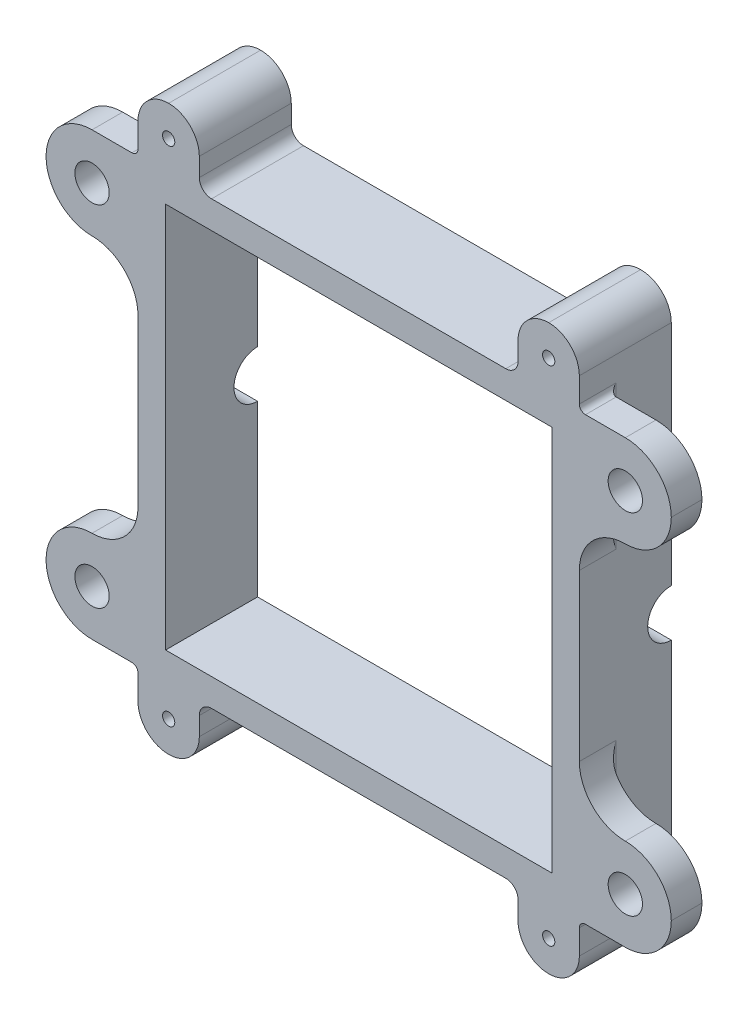
from build123d import *

# Parameters (mm, degrees)
SKETCH1_W            = 91.44
SKETCH1_H            = 91.44
BOSS_EXTRUDE1_DEPTH  = 19.05
SKETCH2_W            = 80.01
SKETCH2_H            = 80.01
CUT_EXTRUDE1_DEPTH   = 68.405780909
SKETCH3_R            = 4.8895
CUT_EXTRUDE2_DEPTH   = 104.992761767
SKETCH4_W            = 12.7
SKETCH4_H            = 12.7
BOSS_EXTRUDE2_DEPTH  = 19.05
SKETCH5_R            = 1.27
CUT_EXTRUDE3_DEPTH   = 77.590582319
FILLET1_R            = 6.35
SKETCH6_W            = 12.7
SKETCH6_H            = 12.7
SKETCH6_R            = 1.27
BOSS_EXTRUDE3_DEPTH  = 19.05
FILLET4_R            = 6.35
FILLET1_OF_MIRROR8_R = 6.35
FILLET4_OF_MIRROR8_R = 6.35
FILLET5_R            = 2.54
SKETCH7_W            = 19.05
SKETCH7_H            = 19.05
SKETCH7_R            = 3.556
BOSS_EXTRUDE4_DEPTH  = 6.35
FILLET6_R            = 9.525
FILLET7_R            = 1.27
FILLET8_R            = 1.27


with BuildPart() as part:
    # Sketch1 → Boss-Extrude1 (new body)
    with BuildSketch(Plane.XY):
        Rectangle(SKETCH1_W, SKETCH1_H)
    extrude(amount=BOSS_EXTRUDE1_DEPTH)

    # Sketch2 → Cut-Extrude1 (cut, through all)
    with BuildSketch(Plane.XY.offset(19.05)):
        Rectangle(SKETCH2_W, SKETCH2_H)
    extrude(amount=-CUT_EXTRUDE1_DEPTH, mode=Mode.SUBTRACT)

    # Sketch3 → Cut-Extrude2 (cut, through all)
    with BuildSketch(Plane(origin=(45.72, 0, 0), x_dir=(0, 0, -1), z_dir=(1, 0, 0))):
        Circle(SKETCH3_R)
        with Locations((0, 57.404)):
            Circle(SKETCH3_R)
        with Locations((0, -57.404)):
            Circle(SKETCH3_R)
    extrude(amount=-CUT_EXTRUDE2_DEPTH, mode=Mode.SUBTRACT)

    # Sketch4 → Boss-Extrude2 (add, through all)
    with BuildSketch(Plane(origin=(0, 0, 0), x_dir=(-1, 0, 0), z_dir=(0, 0, -1))):
        with Locations((-39.37, 52.07)):
            Rectangle(SKETCH4_W, SKETCH4_H)
    boss_extrude2 = extrude(amount=-BOSS_EXTRUDE2_DEPTH)

    # Sketch5 → Cut-Extrude3 (cut, through all)
    with BuildSketch(Plane.XY.offset(19.05)):
        with Locations((39.37, 52.07)):
            Circle(SKETCH5_R)
    cut_extrude3 = extrude(amount=-CUT_EXTRUDE3_DEPTH, mode=Mode.SUBTRACT)

    # Fillet1
    fillet1_edges = [part.edges().sort_by_distance(p)[0] for p in [
        (33.02, 58.42, 9.525),
        (45.72, 58.42, 9.525),
    ]]
    fillet(fillet1_edges, radius=FILLET1_R - 0.0001)  # a hair under: the kernel refuses the full size

    # Sketch6 → Boss-Extrude3 (add, through all)
    with BuildSketch(Plane(origin=(0, 0, 0), x_dir=(-1, 0, 0), z_dir=(0, 0, -1))):
        with Locations((-39.37, -52.07)):
            Rectangle(SKETCH6_W, SKETCH6_H)
        with Locations((-39.37, -52.07)):
            Circle(SKETCH6_R, mode=Mode.SUBTRACT)
    boss_extrude3 = extrude(amount=-BOSS_EXTRUDE3_DEPTH)

    # Fillet4
    fillet4_edges = [part.edges().sort_by_distance(p)[0] for p in [
        (45.72, -58.42, 9.525),
        (33.02, -58.42, 9.525),
    ]]
    fillet(fillet4_edges, radius=FILLET4_R - 0.0001)  # a hair under: the kernel refuses the full size

    # Mirror8: Boss-Extrude2, Cut-Extrude3, Boss-Extrude3 across plane
    add(boss_extrude2.mirror(Plane(origin=(0, 0, 0), x_dir=(0, 0, 1), z_dir=(1, 0, 0))))
    add(cut_extrude3.mirror(Plane(origin=(0, 0, 0), x_dir=(0, 0, 1), z_dir=(1, 0, 0))), mode=Mode.SUBTRACT)
    add(boss_extrude3.mirror(Plane(origin=(0, 0, 0), x_dir=(0, 0, 1), z_dir=(1, 0, 0))))

    # Fillet1 of Mirror8
    fillet1_of_mirror8_edges = [part.edges().sort_by_distance(p)[0] for p in [
        (-33.02, 58.42, 9.525),
        (-45.72, 58.42, 9.525),
    ]]
    fillet(fillet1_of_mirror8_edges, radius=FILLET1_OF_MIRROR8_R - 0.0001)  # a hair under: the kernel refuses the full size

    # Fillet4 of Mirror8
    fillet4_of_mirror8_edges = [part.edges().sort_by_distance(p)[0] for p in [
        (-45.72, -58.42, 9.525),
        (-33.02, -58.42, 9.525),
    ]]
    fillet(fillet4_of_mirror8_edges, radius=FILLET4_OF_MIRROR8_R - 0.0001)  # a hair under: the kernel refuses the full size

    # Fillet5
    fillet5_edges = [part.edges().sort_by_distance(p)[0] for p in [
        (-33.02, 45.72, 9.525),
        (-33.02, -45.72, 9.525),
        (33.02, 45.72, 9.525),
        (33.02, -45.72, 9.525),
    ]]
    fillet(fillet5_edges, radius=FILLET5_R)

    # Sketch7 → Boss-Extrude4 (add)
    # profile 1 of 4: a face of its own
    with BuildSketch(Plane.XY.offset(19.05)):
        with Locations((-55.245, 36.195)):
            Rectangle(SKETCH7_W, SKETCH7_H)
        with Locations((-55.245, 36.195)):
            Circle(SKETCH7_R, mode=Mode.SUBTRACT)
    # profile 2 of 4: a face of its own
    with BuildSketch(Plane.XY.offset(19.05)):
        with Locations((-55.245, -36.195)):
            Rectangle(SKETCH7_W, SKETCH7_H)
        with Locations(Location((-55.245, -36.195, 0), (0, 0, 180))):
            Circle(SKETCH7_R, mode=Mode.SUBTRACT)
    # profile 3 of 4: a face of its own
    with BuildSketch(Plane.XY.offset(19.05)):
        with Locations((55.245, 36.195)):
            Rectangle(SKETCH7_W, SKETCH7_H)
        with Locations(Location((55.245, 36.195, 0), (0, 0, 180))):
            Circle(SKETCH7_R, mode=Mode.SUBTRACT)
    # profile 4 of 4: a face of its own
    with BuildSketch(Plane.XY.offset(19.05)):
        with Locations((55.245, -36.195)):
            Rectangle(SKETCH7_W, SKETCH7_H)
        with Locations((55.245, -36.195)):
            Circle(SKETCH7_R, mode=Mode.SUBTRACT)
    extrude(amount=-BOSS_EXTRUDE4_DEPTH)

    # Fillet6
    fillet6_edges = [part.edges().sort_by_distance(p)[0] for p in [
        (64.77, -45.72, 15.875),
        (45.72, -26.67, 15.875),
        (64.77, -26.67, 15.875),
        (45.72, 26.67, 15.875),
        (64.77, 26.67, 15.875),
        (64.77, 45.72, 15.875),
        (-45.72, 26.67, 15.875),
        (-64.77, 45.72, 15.875),
        (-64.77, 26.67, 15.875),
        (-45.72, -26.67, 15.875),
        (-64.77, -45.72, 15.875),
        (-64.77, -26.67, 15.875),
    ]]
    fillet(fillet6_edges, radius=FILLET6_R - 0.0001)  # a hair under: the kernel refuses the full size

    # Fillet7
    fillet7_edges = [part.edges().sort_by_distance(p)[0] for p in [
        (-45.72, 31.43255, 12.7),
        (-45.72, -31.43255, 12.7),
        (45.72, 31.43255, 12.7),
        (45.72, -31.43255, 12.7),
    ]]
    fillet(fillet7_edges, radius=FILLET7_R)

    # Fillet8
    fillet8_edges = [part.edges().sort_by_distance(p)[0] for p in [
        (-45.72, 45.72, 15.24),
        (-45.72, -45.72, 15.24),
        (45.72, -45.72, 15.24),
        (45.72, 45.72, 15.24),
    ]]
    fillet(fillet8_edges, radius=FILLET8_R)


solid = part.part
